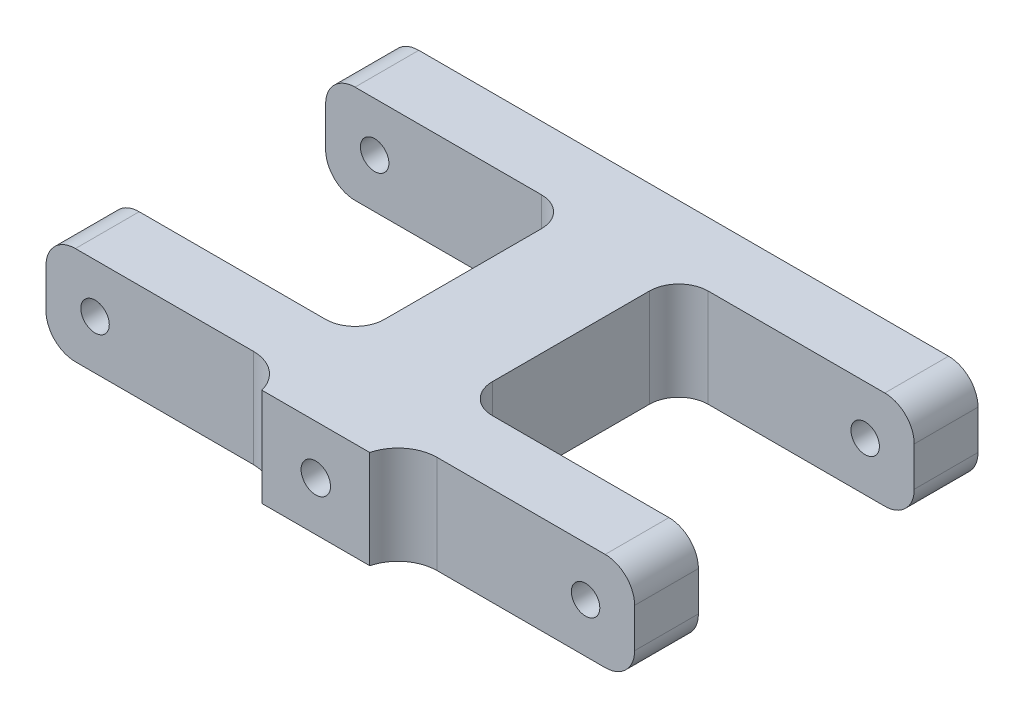
from build123d import *

# Parameters (mm, degrees)
SKETCH1_W               = 60
SKETCH1_H               = 35
BOSS_EXTRUDE1_DEPTH     = 10
SKETCH2_W               = 22
SKETCH2_H               = 10
CUT_EXTRUDE1_DEPTH      = 24
SKETCH3_W               = 22
SKETCH3_H               = 10
CUT_EXTRUDE2_DEPTH      = 25
SKETCH5_R               = 1.45
CUT_EXTRUDE4_DEPTH      = 71.178344238
FILLET1_R               = 3
FILLET2_R               = 3
SKETCH7_W               = 11
SKETCH7_H               = 10
BOSS_EXTRUDE2_DEPTH     = 3
CUT_EXTRUDE5_DEPTH      = 3
CUT_EXTRUDE5_DEPTH_BACK = 15
SKETCH6_R               = 1.5
FILLET3_R               = 4


with BuildPart() as part:
    # Sketch1 → Boss-Extrude1 (new body)
    with BuildSketch(Plane(origin=(0, 0, 0), x_dir=(1, 0, 0), z_dir=(0, 1, 0))):
        with Locations((30, -17.5)):
            Rectangle(SKETCH1_W, SKETCH1_H)
    extrude(amount=BOSS_EXTRUDE1_DEPTH)

    # Sketch2 → Cut-Extrude1 (cut)
    with BuildSketch(Plane(origin=(60, 0, 0), x_dir=(0, 0, -1), z_dir=(1, 0, 0))):
        with Locations((-17.5, 5)):
            Rectangle(SKETCH2_W, SKETCH2_H)
    extrude(amount=-CUT_EXTRUDE1_DEPTH, mode=Mode.SUBTRACT)

    # Sketch3 → Cut-Extrude2 (cut)
    with BuildSketch(Plane.ZY):
        with Locations((17.5, 5)):
            Rectangle(SKETCH3_W, SKETCH3_H)
    extrude(amount=-CUT_EXTRUDE2_DEPTH, mode=Mode.SUBTRACT)

    # Sketch5 → Cut-Extrude4 (cut, through all)
    with BuildSketch(Plane.XY.offset(35)):
        with Locations((5, 5)):
            Circle(SKETCH5_R)
        with Locations((55, 5)):
            Circle(SKETCH5_R)
    extrude(amount=-CUT_EXTRUDE4_DEPTH, mode=Mode.SUBTRACT)

    # Fillet1
    fillet1_edges = [part.edges().sort_by_distance(p)[0] for p in [
        (60, 10, 31.75),
        (60, 0, 3.25),
        (60, 10, 3.25),
        (0, 0, 31.75),
        (0, 10, 31.75),
        (0, 10, 3.25),
        (60, 0, 31.75),
        (0, 0, 3.25),
    ]]
    fillet(fillet1_edges, radius=FILLET1_R)

    # Fillet2
    fillet2_edges = [part.edges().sort_by_distance(p)[0] for p in [
        (36, 5, 28.5),
        (36, 5, 6.5),
        (25, 5, 6.5),
        (25, 5, 28.5),
    ]]
    fillet(fillet2_edges, radius=FILLET2_R)

    # Sketch7 → Boss-Extrude2 (add)
    with BuildSketch(Plane.XY.offset(35)):
        with Locations((30.5, 5)):
            Rectangle(SKETCH7_W, SKETCH7_H)
    extrude(amount=BOSS_EXTRUDE2_DEPTH)

    # Sketch6 → Cut-Extrude5 (cut, two sides: drawn at the far end of the back side and taken through both)
    with BuildSketch(Plane.XY.offset(35).offset(-CUT_EXTRUDE5_DEPTH_BACK)):
        with Locations((30.5, 5)):
            Circle(SKETCH6_R)
    extrude(amount=CUT_EXTRUDE5_DEPTH + CUT_EXTRUDE5_DEPTH_BACK, mode=Mode.SUBTRACT)

    # Fillet3
    # the kernel refuses this fillet: 4 mm, written as the material it adds along each edge
    with BuildSketch(Plane(origin=(36, 10, 35), x_dir=(0, 0, 1), z_dir=(0, -1, 0))) as fillet3_piece_1:
        with BuildLine():
            CenterArc((4, -3.872983346), FILLET3_R, 104.477512186, 75.522487814)
            Line((0, -3.872983346), (-0.08, -3.872983346))
            Line((-0.08, -3.872983346), (-0.08, 0))
            Line((-0.08, 0), (0, 0.08))
            ThreePointArc((0, 0.08), (1.5, 0.08), (2.98, 0.077459667))
            Line((2.98, 0.077459667), (3, 0))
        make_face()
    extrude(amount=10)
    with BuildSketch(Plane(origin=(25, 0, 35), x_dir=(-1, 0, 0), z_dir=(0, 1, 0))) as fillet3_piece_2:
        with BuildLine():
            CenterArc((3.872983346, 4), FILLET3_R, 194.477512186, 75.522487814)
            Line((0, 3), (-0.077459667, 2.98))
            ThreePointArc((-0.077459667, 2.98), (-0.08, 1.5), (-0.08, 0))
            Line((-0.08, 0), (0, -0.08))
            Line((0, -0.08), (3.872983346, -0.08))
            Line((3.872983346, -0.08), (3.872983346, 0))
        make_face()
    extrude(amount=10)


solid = part.part
